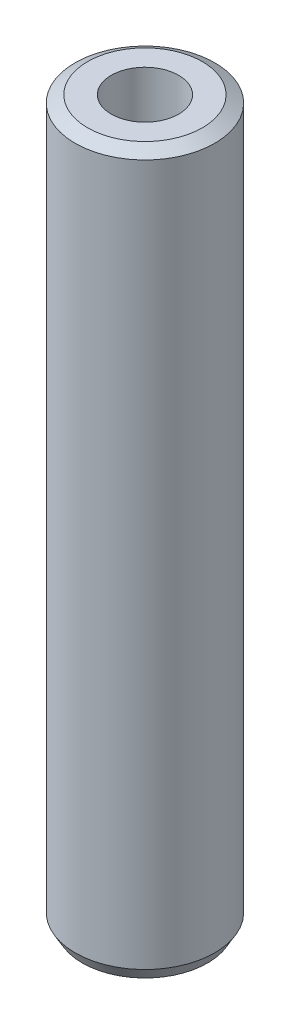
from build123d import *
from OCP.BRepFilletAPI import BRepFilletAPI_MakeChamfer

# Parameters (mm, degrees)
SKETCH1_R           = 35
BOSS_EXTRUDE1_DEPTH = 361.280145549
SKETCH2_R           = 16.891927734
CUT_EXTRUDE1_DEPTH  = 365.65510221
CHAMFER1_SIZE       = 3.599264958
CHAMFER1_SIZE2      = 6.234109778


with BuildPart() as part:
    # Sketch1 → Boss-Extrude1 (new body)
    with BuildSketch(Plane(origin=(0, 0, 0), x_dir=(1, 0, 0), z_dir=(0, 1, 0))):
        Circle(SKETCH1_R)
    extrude(amount=BOSS_EXTRUDE1_DEPTH)

    # Sketch2 → Cut-Extrude1 (cut, through all)
    with BuildSketch(Plane(origin=(0, 0, 0), x_dir=(1, 0, 0), z_dir=(0, 1, 0))):
        Circle(SKETCH2_R)
    extrude(amount=CUT_EXTRUDE1_DEPTH, mode=Mode.SUBTRACT)

    # Chamfer1: one chamfer whose edges measure the first distance from different faces: ONE call of the kernel's chamfer builder (chamfer() names one face for all edges)
    chamfer1_edges_1 = [part.edges().sort_by_distance(p)[0] for p in [
        (-35, 361.280145549, 0),
    ]]
    chamfer1_side_1 = [part.faces().sort_by_distance(p)[0] for p in [
        (-35, 180.640072774, 0),
    ]]
    chamfer1_edges_2 = [part.edges().sort_by_distance(p)[0] for p in [
        (-35, 0, 0),
    ]]
    chamfer1_side_2 = [part.faces().sort_by_distance(p)[0] for p in [
        (-34.010050506, 0, 0),
    ]]
    chamfer1 = BRepFilletAPI_MakeChamfer(part.part.solid().wrapped)
    for e in chamfer1_edges_1:
        chamfer1.Add(CHAMFER1_SIZE, CHAMFER1_SIZE2, e.wrapped, chamfer1_side_1[0].wrapped)  # the first distance lies on this face
    for e in chamfer1_edges_2:
        chamfer1.Add(CHAMFER1_SIZE, CHAMFER1_SIZE2, e.wrapped, chamfer1_side_2[0].wrapped)  # the first distance lies on this face
    add(Compound.cast(chamfer1.Shape()), mode=Mode.REPLACE)


solid = part.part
